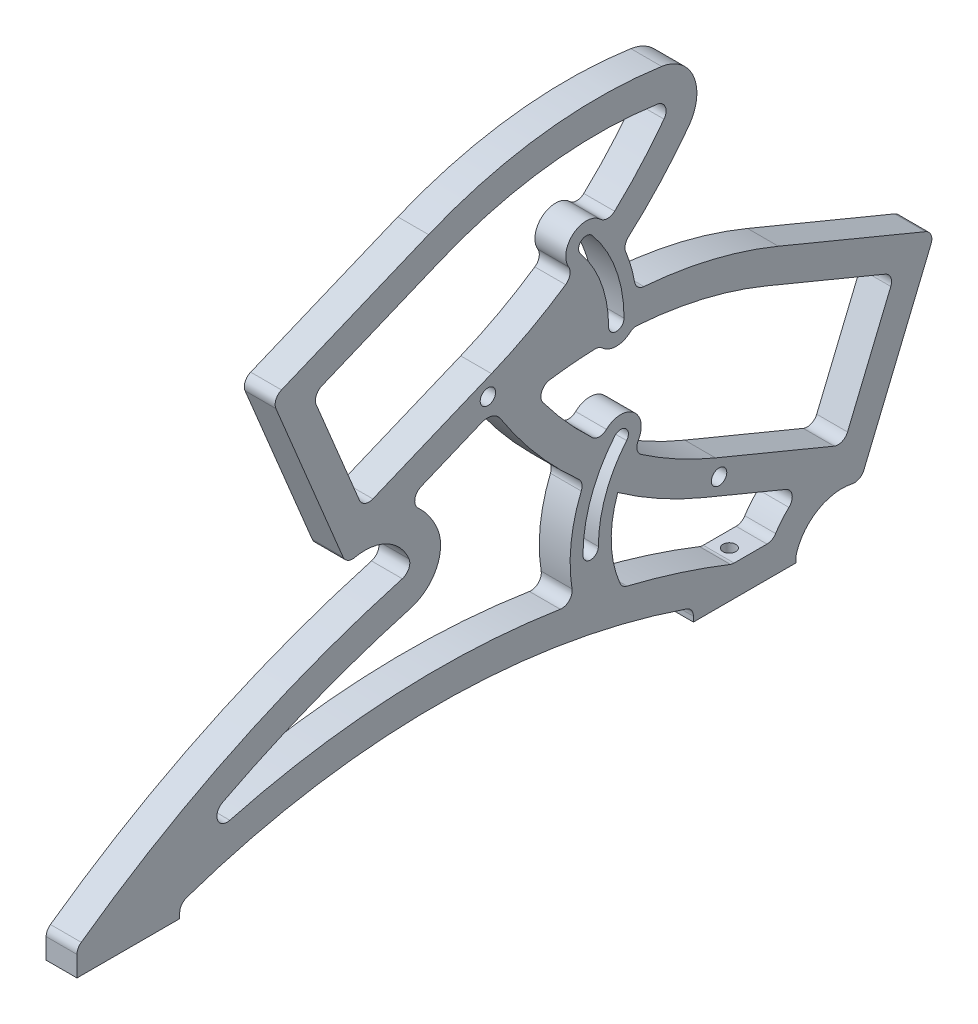
from build123d import *

# Parameters (mm, degrees)
SKETCH1_R                   = 1.5
BOSS_EXTRUDE1_DEPTH         = 6
FILLET1_R                   = 2
TAP_DRILL_FOR_M3_TAP1_D     = 2.5
TAP_DRILL_FOR_M3_TAP1_DEPTH = 10
TAP_DRILL_FOR_M3_TAP1_TIP   = 0.751075774


with BuildPart() as part:
    # Sketch1 → Boss-Extrude1 (new body)
    with BuildSketch(Plane(origin=(0, 0, 0), x_dir=(0, 0, -1), z_dir=(1, 0, 0))):
        with BuildLine():
            Line((0, 0), (0, 5))
            ThreePointArc((0, 5), (30.306872644, 23.131839172), (63.330515184, 35.650191885))
            ThreePointArc((63.330515184, 35.650191885), (64.588559877, 36.701940492), (64.63724154, 38.340989509))
            ThreePointArc((64.63724154, 38.340989509), (59.61305605, 43.365174999), (52.507784789, 43.365174999))
            Line((52.507784789, 43.365174999), (37.965814359, 78.472597235))
            Line((37.965814359, 78.472597235), (68.453838932, 91.101150503))
            ThreePointArc((68.453838932, 91.101150503), (90.75830388, 96.999189804), (113.828292623, 96.77193757))
            ThreePointArc((113.828292623, 96.77193757), (120.071041901, 91.916244219), (119.090245249, 84.068460175))
            ThreePointArc((119.090245249, 84.068460175), (113.049914532, 76.838922764), (106.256946475, 70.311489017))
            ThreePointArc((106.256946475, 70.311489017), (107.872116673, 66.009064376), (108.787347676, 61.505511914))
            ThreePointArc((108.787347676, 61.505511914), (122.933070277, 59.457640443), (136.546161068, 55.101150503))
            Line((136.546161068, 55.101150503), (167.034185641, 42.472597235))
            Line((167.034185641, 42.472597235), (152.492215211, 7.365174999))
            ThreePointArc((152.492215211, 7.365174999), (145.029217261, 7.208101321), (140.094434117, 1.607304426))
            ThreePointArc((140.094434117, 1.607304426), (140.023749539, 1.307301346), (140, 1))
            Line((140, 1), (140, 0))
            Line((140, 0), (120, 0))
            Line((120, 0), (120, 1))
            ThreePointArc((120, 1), (119.627466942, 2.162476387), (118.648648649, 2.891891892))
            ThreePointArc((118.648648649, 2.891891892), (70, 11), (21.351351351, 2.891891892))
            ThreePointArc((21.351351351, 2.891891892), (20.372533058, 2.162476387), (20, 1))
            Line((20, 1), (20, 0))
            Line((20, 0), (0, 0))
        make_face()
        with Locations((80, 58)):
            Circle(SKETCH1_R, mode=Mode.SUBTRACT)
        with Locations((125, 22)):
            Circle(SKETCH1_R, mode=Mode.SUBTRACT)
        with BuildLine():
            Line((63.72452745, 48.011301935), (78.759163305, 54.238852011))
            ThreePointArc((78.759163305, 54.238852011), (80.804603663, 54.329850498), (82.432049006, 53.087462216))
            ThreePointArc((82.432049006, 53.087462216), (89.907026456, 43.108292239), (98.743053525, 34.311489017))
            ThreePointArc((98.743053525, 34.311489017), (96.120508219, 24.64101391), (96.9455023, 14.655263189))
            ThreePointArc((96.9455023, 14.655263189), (53.555187376, 16.130809763), (11.438572835, 5.591006803))
            ThreePointArc((11.438572835, 5.591006803), (37.27128416, 19.770562369), (64.953613309, 29.873899607))
            ThreePointArc((64.953613309, 29.873899607), (69.985792082, 34.080894036), (70.180518735, 40.637090103))
            ThreePointArc((70.180518735, 40.637090103), (67.559666076, 44.855738901), (63.72452745, 48.011301935))
        make_face(mode=Mode.SUBTRACT)
        with BuildLine():
            Line((80.699708768, 61.537005462), (55.75496139, 51.204552788))
            Line((55.75496139, 51.204552788), (45.805192149, 75.225420634))
            Line((45.805192149, 75.225420634), (70.749939526, 85.557873308))
            ThreePointArc((70.749939526, 85.557873308), (91.502380524, 91.045506075), (112.967077451, 90.834066872))
            ThreePointArc((112.967077451, 90.834066872), (114.527764673, 89.620143611), (114.282565525, 87.658197723))
            ThreePointArc((114.282565525, 87.658197723), (109.007019808, 81.303334108), (103.10607381, 75.524535746))
            ThreePointArc((103.10607381, 75.524535746), (102.66755418, 76.088172585), (102.21528885, 76.640840681))
            ThreePointArc((102.21528885, 76.640840681), (96.579960639, 77.133868015), (96.086933305, 71.498539803))
            ThreePointArc((96.086933305, 71.498539803), (96.4758084, 71.021049787), (96.850515773, 70.532362833))
            ThreePointArc((96.850515773, 70.532362833), (89.035079567, 65.567923188), (80.699708768, 61.537005462))
        make_face(mode=Mode.SUBTRACT)
        with BuildLine():
            Line((124.300291232, 25.537005462), (149.24503861, 15.204552788))
            Line((149.24503861, 15.204552788), (159.194807851, 39.225420634))
            Line((159.194807851, 39.225420634), (134.250060474, 49.557873308))
            ThreePointArc((134.250060474, 49.557873308), (121.450314093, 53.641995786), (108.148496928, 55.532822038))
            ThreePointArc((108.148496928, 55.532822038), (104.929684106, 54.000618088), (101.766721463, 55.645024437))
            ThreePointArc((101.766721463, 55.645024437), (96.887469134, 55.387817162), (92.032922859, 54.834066917))
            ThreePointArc((92.032922859, 54.834066917), (90.472235487, 53.620143544), (90.717434663, 51.658197472))
            ThreePointArc((90.717434663, 51.658197472), (95.992980298, 45.303333993), (101.89392619, 39.524535746))
            ThreePointArc((101.89392619, 39.524535746), (102.33244582, 40.088172585), (102.78471115, 40.640840681))
            ThreePointArc((102.78471115, 40.640840681), (108.420039361, 41.133868015), (108.913066695, 35.498539803))
            ThreePointArc((108.913066695, 35.498539803), (108.5241916, 35.021049787), (108.149484227, 34.532362833))
            ThreePointArc((108.149484227, 34.532362833), (115.964920433, 29.567923188), (124.300291232, 25.537005462))
        make_face(mode=Mode.SUBTRACT)
        with BuildLine():
            Line((122.004190638, 19.993728267), (141.27547255, 12.011301935))
            ThreePointArc((141.27547255, 12.011301935), (137.950950961, 9.410732752), (135.464526627, 6))
            Line((135.464526627, 6), (127.541289523, 6))
            ThreePointArc((127.541289523, 6), (116.964502802, 9.762681734), (106.144506127, 12.754982379))
            ThreePointArc((106.144506127, 12.754982379), (104.029107455, 20.894710056), (105.277139326, 29.211710396))
            ThreePointArc((105.277139326, 29.211710396), (113.384661496, 24.138172602), (122.004190638, 19.993728267))
        make_face(mode=Mode.SUBTRACT)
        with BuildLine():
            ThreePointArc((106.5, 58), (104.901854451, 67.063533798), (100.300177743, 75.033871657))
            ThreePointArc((100.300177743, 75.033871657), (98.186929663, 75.218756907), (98.002044413, 73.105508828))
            ThreePointArc((98.002044413, 73.105508828), (102.082776588, 66.037473368), (103.5, 58))
            ThreePointArc((103.5, 58), (105, 56.5), (106.5, 58))
        make_face(mode=Mode.SUBTRACT)
        with BuildLine():
            ThreePointArc((104.699822257, 39.033871657), (100.098145549, 31.063533798), (98.5, 22))
            ThreePointArc((98.5, 22), (100, 20.5), (101.5, 22))
            ThreePointArc((101.5, 22), (102.917223412, 30.037473368), (106.997955587, 37.105508828))
            ThreePointArc((106.997955587, 37.105508828), (106.813070337, 39.218756907), (104.699822257, 39.033871657))
        make_face(mode=Mode.SUBTRACT)
    extrude(amount=BOSS_EXTRUDE1_DEPTH)

    # Fillet1
    fillet1_edges = [part.edges().sort_by_distance(p)[0] for p in [
        (3, 14.655263189, -96.9455023),
        (3, 34.311489017, -98.743053525),
        (3, 12.754982379, -106.144506127),
        (3, 12.011301935, -141.27547255),
        (3, 6, -135.464526627),
        (3, 6, -127.541289523),
        (3, 39.524535746, -101.89392619),
        (3, 34.532362833, -108.149484227),
        (3, 15.204552788, -149.24503861),
        (3, 39.225420634, -159.194807851),
        (3, 42.472597235, -167.034185641),
        (3, 7.365174999, -152.492215211),
        (3, 75.524535746, -103.10607381),
        (3, 70.532362833, -96.850515773),
        (3, 51.204552788, -55.75496139),
        (3, 78.472597235, -37.965814359),
        (3, 75.225420634, -45.805192149),
        (3, 43.365174999, -52.507784789),
        (3, 48.011301935, -63.72452745),
        (3, 5.591006803, -11.438572835),
        (3, 5, 0),
        (3, 55.532822038, -108.148496928),
        (3, 55.645024437, -101.766721463),
        (3, 61.505511914, -108.787347676),
        (3, 70.311489017, -106.256946475),
    ]]
    fillet(fillet1_edges, radius=FILLET1_R)

    # Tap Drill for M3 Tap1
    with Locations(Plane(origin=(0, 0, 0), x_dir=(-1, 0, 0), z_dir=(0, -1, 0))):
        with Locations((-3, 10), (-3, 130)):
            Hole(TAP_DRILL_FOR_M3_TAP1_D / 2, depth=TAP_DRILL_FOR_M3_TAP1_DEPTH)
            with Locations((0, 0, -(TAP_DRILL_FOR_M3_TAP1_DEPTH + TAP_DRILL_FOR_M3_TAP1_TIP / 2))):  # 118° drill point
                Cone(0, TAP_DRILL_FOR_M3_TAP1_D / 2, TAP_DRILL_FOR_M3_TAP1_TIP, mode=Mode.SUBTRACT)


solid = part.part
